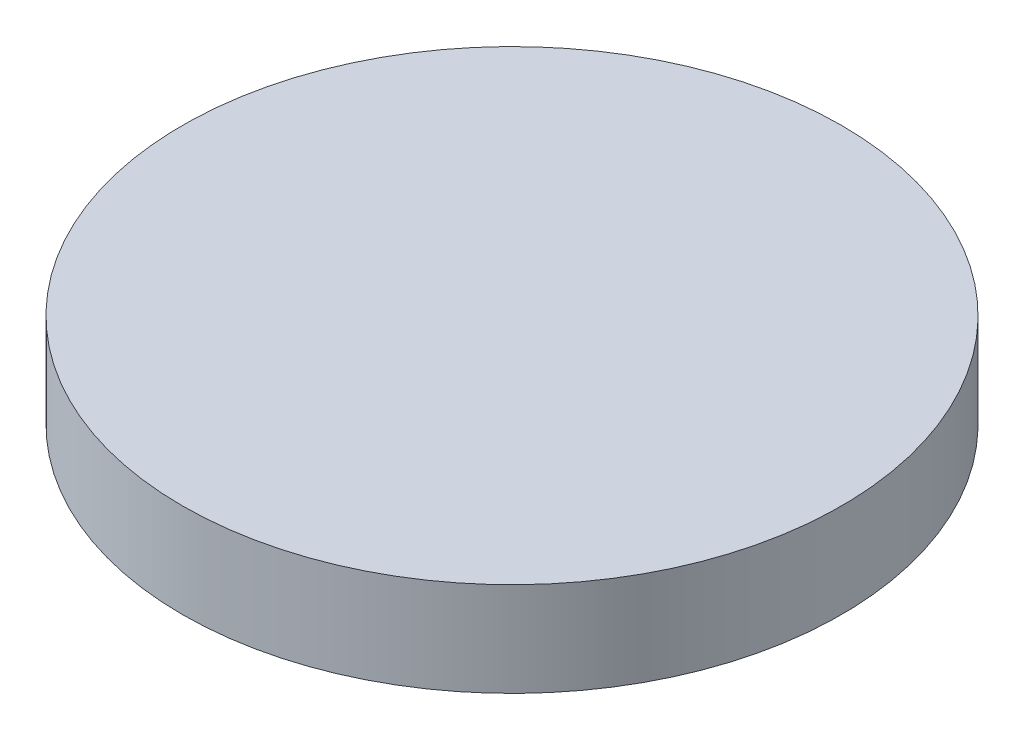
from build123d import *

# Parameters (mm, degrees)
SKETCH1_R           = 10.5
BOSS_EXTRUDE1_DEPTH = 3


with BuildPart() as part:
    # Sketch1 → Boss-Extrude1 (new body)
    with BuildSketch(Plane(origin=(0, 0, 0), x_dir=(1, 0, 0), z_dir=(0, 1, 0))):
        Circle(SKETCH1_R)
    extrude(amount=BOSS_EXTRUDE1_DEPTH)


solid = part.part
